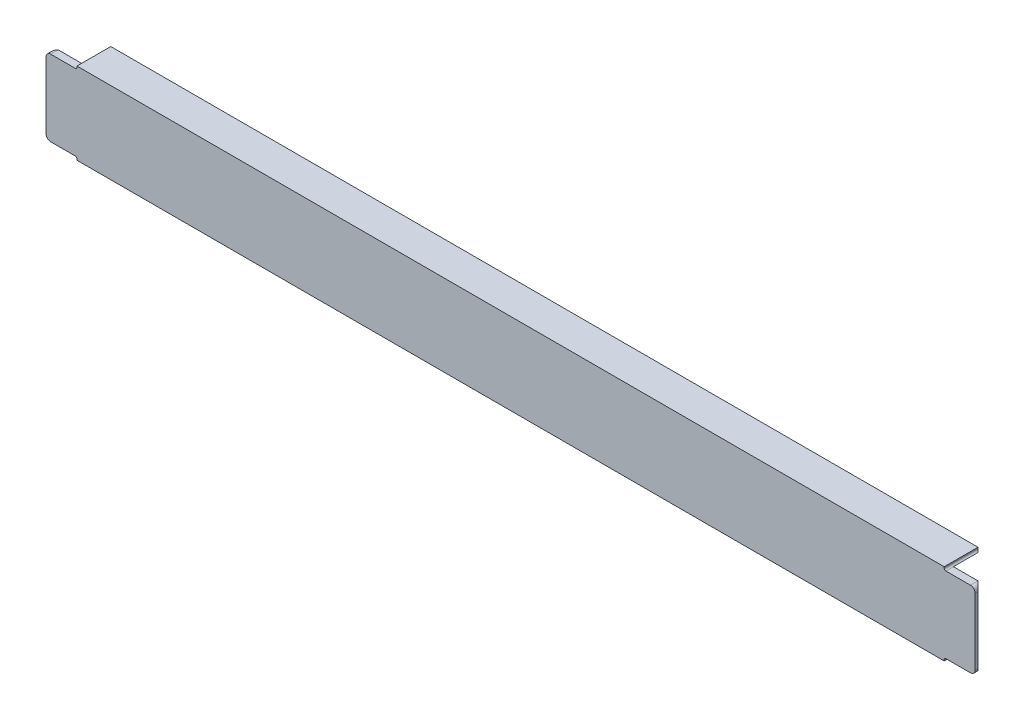
from build123d import *

# Parameters (mm, degrees)
EXTRUDE_1_DEPTH = 796.883643365
OTHER_1_DEPTH   = 58


# Read off the part's stored shape, not the designer's step: Полость1
with BuildPart() as part:
    # Эскиз2 → Бобышка-Вытянуть1 (new body)
    with BuildSketch(Plane(origin=(0, 0, 0), x_dir=(0, 0, -1), z_dir=(1, 0, 0))):
        with BuildLine():
            Line((-58, -140), (-58, 0))
            Line((-58, 0), (0, 0))
            Line((0, 0), (0, -1.9))
            ThreePointArc((0, -1.9), (-0.878679656, -4.021320344), (-3, -4.9))
            Line((-3, -4.9), (-45.1, -4.9))
            ThreePointArc((-45.1, -4.9), (-50.756854249, -7.243145751), (-53.1, -12.9))
            Line((-53.1, -12.9), (-53.1, -127.1))
            ThreePointArc((-53.1, -127.1), (-50.756854249, -132.756854249), (-45.1, -135.1))
            Line((-45.1, -135.1), (-3, -135.1))
            ThreePointArc((-3, -135.1), (-0.878679656, -135.978679656), (0, -138.1))
            Line((0, -138.1), (0, -140))
            Line((0, -140), (-58, -140))
        make_face()
    extrude(amount=-EXTRUDE_1_DEPTH)

    # Полость1 outline → Полость1 (cut)
    with BuildSketch(Plane.XY):
        with BuildLine():
            Line((-796.883643365, -140), (-743.783643365, -140))
            Line((-743.783643365, -140), (-743.783643365, -138.1))
            ThreePointArc((-743.783643365, -138.1), (-744.662323022, -135.978679656), (-746.783643365, -135.1))
            Line((-746.783643365, -135.1), (-788.883643365, -135.1))
            ThreePointArc((-788.883643365, -135.1), (-794.540497615, -132.75685425), (-796.883643365, -127.1))
            Line((-796.883643365, -127.1), (-796.883643365, -140))
        make_face()
        with BuildLine():
            ThreePointArc((-796.883643365, -12.9), (-794.540497615, -7.24314575), (-788.883643365, -4.9))
            Line((-788.883643365, -4.9), (-746.783643365, -4.9))
            ThreePointArc((-746.783643365, -4.9), (-744.662323022, -4.021320343), (-743.783643365, -1.9))
            Line((-743.783643365, -1.9), (-743.783643365, 0))
            Line((-743.783643365, 0), (-796.883643365, 0))
            Line((-796.883643365, 0), (-796.883643365, -12.9))
        make_face()
    extrude(amount=OTHER_1_DEPTH, mode=Mode.SUBTRACT)

    # Зеркальное отражение1: part across plane


with BuildPart() as part_1:
    add(part.part)
    add(part.part.mirror(Plane(origin=(0, -1.9, 3), x_dir=(0, 0, 1), z_dir=(-1, 0, 0))))


solid = part_1.part
